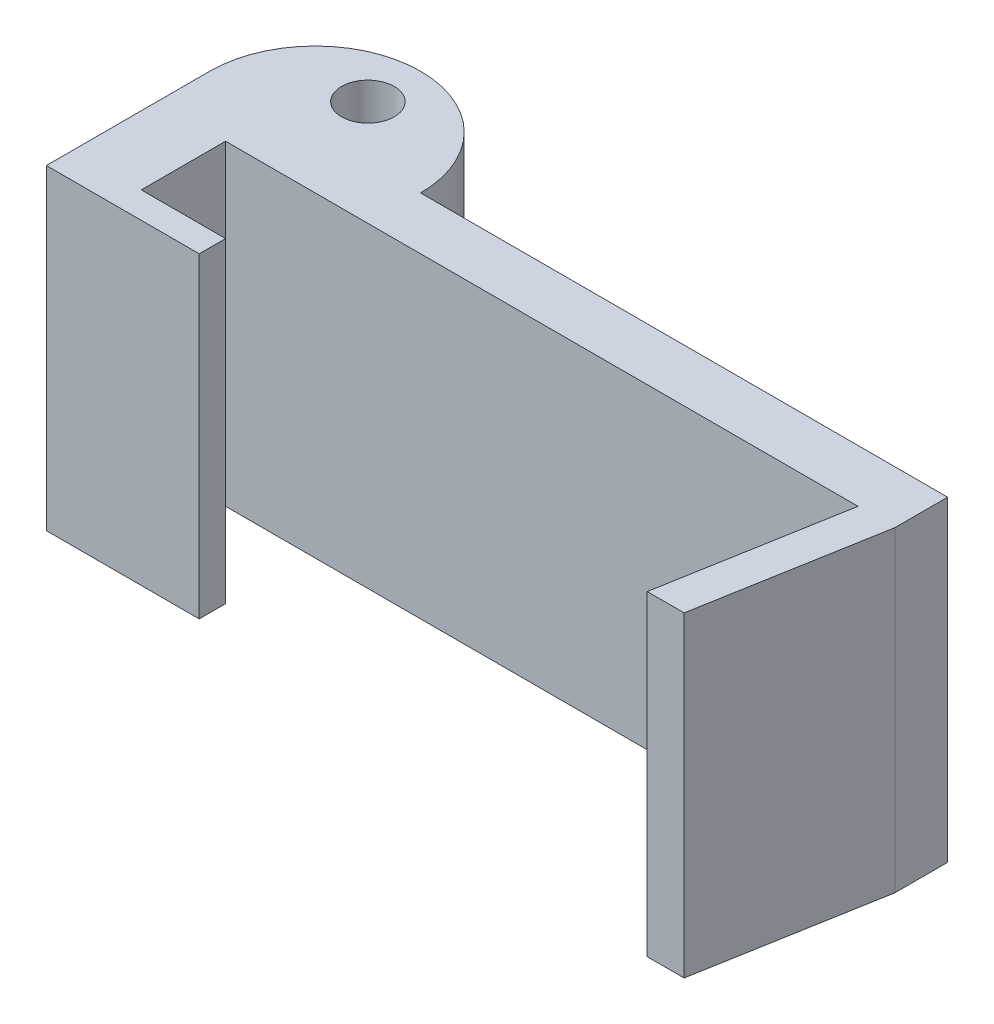
from build123d import *

# Parameters (mm, degrees)
SKETCH1_R           = 0.5
BOSS_EXTRUDE1_DEPTH = 6


with BuildPart() as part:
    # Sketch1 → Boss-Extrude1 (new body)
    with BuildSketch(Plane(origin=(0, 0, 0), x_dir=(1, 0, 0), z_dir=(0, 1, 0))):
        with BuildLine():
            ThreePointArc((4, 0), (2, 2), (0, 0))
            Line((0, 0), (0, -3.1))
            Line((0, -3.1), (2.9, -3.1))
            Line((2.9, -3.1), (2.9, -2.6))
            Line((2.9, -2.6), (1.3, -2.6))
            Line((1.3, -2.6), (1.3, -1))
            Line((1.3, -1), (13.3, -1))
            Line((13.3, -1), (12.700488266, -4.4))
            Line((12.700488266, -4.4), (13.400488266, -4.4))
            Line((13.400488266, -4.4), (14, -1))
            Line((14, -1), (14, 0))
            Line((14, 0), (4, 0))
        make_face()
        with Locations((2, 1)):
            Circle(SKETCH1_R, mode=Mode.SUBTRACT)
    extrude(amount=BOSS_EXTRUDE1_DEPTH)


solid = part.part
